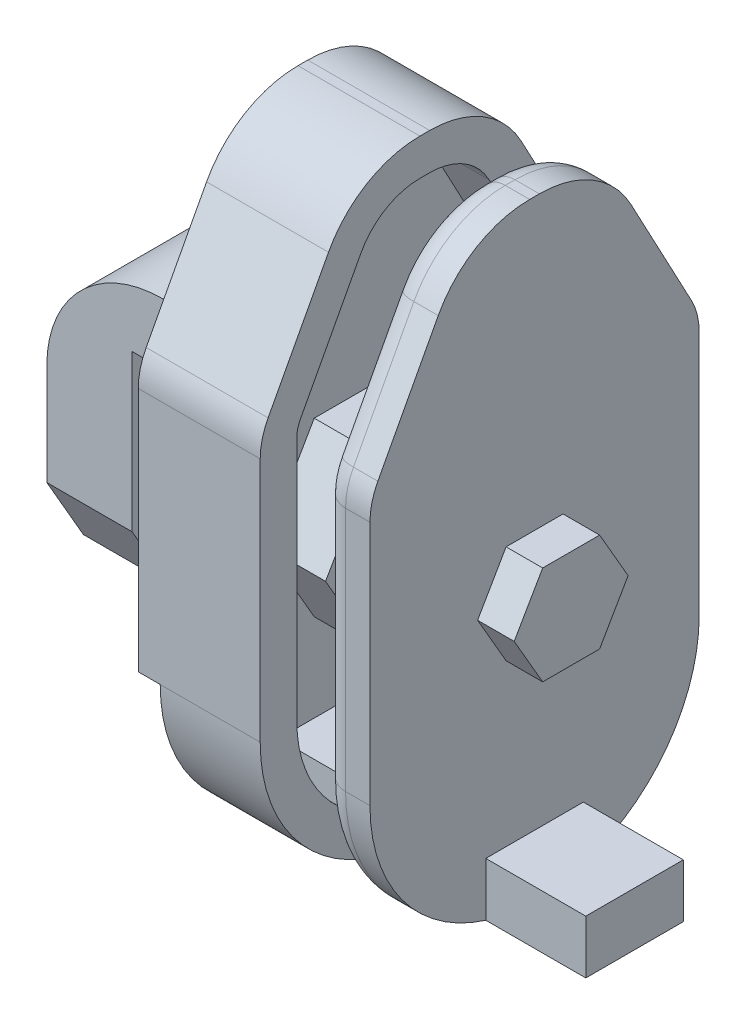
from build123d import *

# Parameters (mm, degrees)
BOSS_EXTRUDE1_DEPTH = 7
FILLET1_R           = 8.5
FILLET2_R           = 5.5
FILLET3_R           = 13.5
SKETCH3_W           = 27
SKETCH3_H           = 13.5
CUT_EXTRUDE1_DEPTH  = 1.8
BOSS_EXTRUDE2_DEPTH = 5
BOSS_EXTRUDE3_DEPTH = 7
SKETCH10_R          = 2.5
CUT_EXTRUDE3_DEPTH  = 21
CUT_EXTRUDE16_REACH = 42.725
SKETCH19_W          = 12
SKETCH19_H          = 4.5
CHAMFER5_SIZE       = 3
CHAMFER5_SIZE2      = 5.196152423
CUT_EXTRUDE17_DEPTH = 4
SHELL1_START        = -9
SHELL1_OUTLINE_R    = 5.5
SHELL1_DEPTH        = 1
SKETCH21_R          = 4.3
CUT_EXTRUDE18_DEPTH = 5
FILLET5_R           = 9.5
FILLET6_R           = 2.5
BOSS_EXTRUDE5_START = 3
BOSS_EXTRUDE5_DEPTH = 3
SKETCH24_W          = 8
SKETCH24_H          = 10
CUT_EXTRUDE19_DEPTH = 8.2
CUT_EXTRUDE20_DEPTH = 5
BOSS_EXTRUDE6_DEPTH = 4
SKETCH27_W          = 8
SKETCH27_H          = 4.393796958
BOSS_EXTRUDE8_DEPTH = 12.2
BOSS_EXTRUDE9_DEPTH = 3
FILLET8_R           = 2


# Read off the part's stored shape, not the designer's step: Shell1
# Some blends are built 0.0001 mm under size
with BuildPart() as part:
    # Sketch2 → Boss-Extrude1 (new body)
    with BuildSketch(Plane(origin=(0, 0, 0), x_dir=(0, 0, -1), z_dir=(1, 0, 0))):
        Polygon((-13.5, -17.5), (13.5, -17.5), (13.5, 17.5), (5.5, 32.5), (-5.5, 32.5), (-13.5, 17.5), align=None)
    extrude(amount=BOSS_EXTRUDE1_DEPTH)

    # Fillet1
    fillet1_edges = [part.edges().sort_by_distance(p)[0] for p in [
        (3.5, 32.5, 5.5),
        (3.5, 32.5, -5.5),
    ]]
    fillet(fillet1_edges, radius=FILLET1_R)

    # Fillet2
    fillet2_edges = [part.edges().sort_by_distance(p)[0] for p in [
        (3.5, 17.5, -13.5),
        (3.5, 17.5, 13.5),
    ]]
    fillet(fillet2_edges, radius=FILLET2_R)

    # Fillet3
    fillet3_edges = [part.edges().sort_by_distance(p)[0] for p in [
        (3.5, -17.5, 13.5),
        (3.5, -17.5, -13.5),
    ]]
    fillet(fillet3_edges, radius=FILLET3_R - 0.0001)  # a hair under: the kernel refuses the full size

    # Sketch3 → Cut-Extrude1 (cut)
    with BuildSketch(Plane.ZY):
        with Locations((0, -10.75)):
            Rectangle(SKETCH3_W, SKETCH3_H)
    extrude(amount=-CUT_EXTRUDE1_DEPTH, mode=Mode.SUBTRACT)

    # Sketch6 → Boss-Extrude2 (add)
    with BuildSketch(Plane.ZY):
        with BuildLine():
            Line((-13.5, 14), (13.5, 14))
            Line((13.5, 14), (13.5, 16.125))
            ThreePointArc((13.5, 16.125), (13.293303509, 17.618632471), (12.688749833, 19))
            Line((12.688749833, 19), (-12.688749833, 19))
            ThreePointArc((-12.688749833, 19), (-13.293303509, 17.618632471), (-13.5, 16.125))
            Line((-13.5, 16.125), (-13.5, 14))
        make_face()
    extrude(amount=BOSS_EXTRUDE2_DEPTH)

    # Sketch9 → Boss-Extrude3 (add)
    with BuildSketch(Plane.ZY.offset(5)):
        with BuildLine():
            Line((-13.5, 14), (-13.5, -4))
            Line((-13.5, -4), (13.5, -4))
            Line((13.5, -4), (13.5, 14))
            Line((13.5, 14), (13.5, 16.125))
            ThreePointArc((13.5, 16.125), (13.293303509, 17.618632471), (12.688749833, 19))
            Line((12.688749833, 19), (-12.688749833, 19))
            ThreePointArc((-12.688749833, 19), (-13.293303509, 17.618632471), (-13.5, 16.125))
            Line((-13.5, 16.125), (-13.5, 14))
        make_face()
    extrude(amount=BOSS_EXTRUDE3_DEPTH)

    # Sketch10 → Cut-Extrude3 (cut)
    with BuildSketch(Plane(origin=(7, 0, 0), x_dir=(0, 0, -1), z_dir=(1, 0, 0))):
        with Locations((0, 4.75)):
            Circle(SKETCH10_R)
    extrude(amount=-CUT_EXTRUDE3_DEPTH, mode=Mode.SUBTRACT)

    # Sketch19 → Cut-Extrude16 (cut, up to next)
    with BuildSketch(Plane.XZ.offset(4), mode=Mode.PRIVATE) as cut_extrude16_sk1:
        with Locations((-6, -11.25)):
            Rectangle(SKETCH19_W, SKETCH19_H)
    cut_extrude16_tool1 = extrude(cut_extrude16_sk1.sketch, amount=-CUT_EXTRUDE16_REACH, mode=Mode.PRIVATE) & part.part
    # Sketch19 → Cut-Extrude16 (cut, up to next)
    with BuildSketch(Plane.XZ.offset(4), mode=Mode.PRIVATE) as cut_extrude16_sk2:
        with Locations((-6, 11.25)):
            Rectangle(SKETCH19_W, SKETCH19_H)
    cut_extrude16_tool2 = extrude(cut_extrude16_sk2.sketch, amount=-CUT_EXTRUDE16_REACH, mode=Mode.PRIVATE) & part.part
    add(cut_extrude16_tool1.solids().sort_by_distance((-6, -4, -11.25))[0], mode=Mode.SUBTRACT)
    add(cut_extrude16_tool2.solids().sort_by_distance((-6, -4, 11.25))[0], mode=Mode.SUBTRACT)

    # Chamfer5
    chamfer5_edges = [part.edges().sort_by_distance(p)[0] for p in [
        (-8.5, -4, -9),
        (-8.5, -4, 9),
    ]]
    chamfer5_side = [part.faces().sort_by_distance(p)[0] for p in [
        (-8.5, -4, 0),
    ]]
    chamfer(chamfer5_edges, length=CHAMFER5_SIZE, length2=CHAMFER5_SIZE2, reference=chamfer5_side[0])

    # Sketch20 → Cut-Extrude17 (cut)
    with BuildSketch(Plane(origin=(7, 0, 0), x_dir=(0, 0, -1), z_dir=(1, 0, 0))):
        Polygon((2.33826859, 8.8), (-2.33826859, 8.8), (-4.67653718, 4.75), (-2.33826859, 0.7), (2.33826859, 0.7), (4.67653718, 4.75), align=None)
    extrude(amount=-CUT_EXTRUDE17_DEPTH, mode=Mode.SUBTRACT)

    # Shell1 outline → Shell1 (cut)
    with BuildSketch(Plane.YZ.offset(SHELL1_START)):
        Polygon((16, -6), (16, 6), (2, 6), (-1, 4.267949192), (-1, -4.267949192), (2, -6), align=None)
        with Locations((4.75, 0)):
            Circle(SHELL1_OUTLINE_R, mode=Mode.SUBTRACT)
    extrude(amount=SHELL1_DEPTH, mode=Mode.SUBTRACT)

    # Sketch21 → Cut-Extrude18 (cut)
    with BuildSketch(Plane.ZY.offset(12)):
        with Locations((0, 4.75)):
            Circle(SKETCH21_R)
    extrude(amount=-CUT_EXTRUDE18_DEPTH, mode=Mode.SUBTRACT)

    # Fillet5
    fillet5_edges = [part.edges().sort_by_distance(p)[0] for p in [
        (-12, 19, 0),
    ]]
    fillet(fillet5_edges, radius=FILLET5_R)

    # Fillet6
    fillet6_edges = [part.edges().sort_by_distance(p)[0] for p in [
        (0, 19, 0),
    ]]
    fillet(fillet6_edges, radius=FILLET6_R - 0.0001)  # a hair under: the kernel refuses the full size

    # Sketch23 → Boss-Extrude5 (add)
    with BuildSketch(Plane(origin=(7, 0, 0), x_dir=(0, 0, -1), z_dir=(1, 0, 0)).offset(BOSS_EXTRUDE5_START)):
        with BuildLine():
            Line((-13.5, 16.125), (-13.5, -4))
            ThreePointArc((-13.5, -4), (-9.545941546, -13.545941546), (0, -17.5))
            ThreePointArc((0, -17.5), (9.545941546, -13.545941546), (13.5, -4))
            Line((13.5, -4), (13.5, 16.125))
            ThreePointArc((13.5, 16.125), (13.335783751, 17.458945938), (12.852941176, 18.713235294))
            Line((12.852941176, 18.713235294), (7.9, 28))
            ThreePointArc((7.9, 28), (4.773213921, 31.288689869), (0.4, 32.5))
            Line((0.4, 32.5), (-0.4, 32.5))
            ThreePointArc((-0.4, 32.5), (-4.773213921, 31.288689869), (-7.9, 28))
            Line((-7.9, 28), (-12.852941176, 18.713235294))
            ThreePointArc((-12.852941176, 18.713235294), (-13.335783751, 17.458945938), (-13.5, 16.125))
        make_face()
        Polygon((-4.67653718, 4.75), (-2.33826859, 0.7), (2.33826859, 0.7), (4.67653718, 4.75), (2.33826859, 8.8), (-2.33826859, 8.8), align=None, mode=Mode.SUBTRACT)
    extrude(amount=-BOSS_EXTRUDE5_DEPTH)

    # Sketch24 → Cut-Extrude19 (cut)
    with BuildSketch(Plane(origin=(10, 0, 0), x_dir=(0, 0, -1), z_dir=(1, 0, 0))):
        with Locations((0, -17.5)):
            Rectangle(SKETCH24_W, SKETCH24_H)
    extrude(amount=-CUT_EXTRUDE19_DEPTH, mode=Mode.SUBTRACT)

    # Sketch25 → Cut-Extrude20 (cut)
    with BuildSketch(Plane(origin=(10, 0, 0), x_dir=(0, 0, -1), z_dir=(1, 0, 0))):
        with BuildLine():
            Line((7, -9.5), (7, -11.826237921))
            ThreePointArc((7, -11.826237921), (9.585144756, -8.28660705), (10.5, -4))
            Line((10.5, -4), (10.5, 16.125))
            ThreePointArc((10.5, 16.125), (10.42535625, 16.731339063), (10.205882353, 17.301470588))
            Line((10.205882353, 17.301470588), (5.252941176, 26.588235294))
            ThreePointArc((5.252941176, 26.588235294), (3.229726655, 28.716211091), (0.4, 29.5))
            Line((0.4, 29.5), (-0.4, 29.5))
            ThreePointArc((-0.4, 29.5), (-3.229726655, 28.716211091), (-5.252941176, 26.588235294))
            Line((-5.252941176, 26.588235294), (-10.205882353, 17.301470588))
            ThreePointArc((-10.205882353, 17.301470588), (-10.42535625, 16.731339063), (-10.5, 16.125))
            Line((-10.5, 16.125), (-10.5, -4))
            ThreePointArc((-10.5, -4), (-9.585144756, -8.28660705), (-7, -11.826237921))
            Line((-7, -11.826237921), (-7, -9.5))
            Line((-7, -9.5), (7, -9.5))
        make_face()
        Polygon((4.070319398, 11.8), (-4.070319398, 11.8), (-8.140638796, 4.75), (-4.070319398, -2.3), (4.070319398, -2.3), (8.140638796, 4.75), align=None, mode=Mode.SUBTRACT)
    extrude(amount=-CUT_EXTRUDE20_DEPTH, mode=Mode.SUBTRACT)


with BuildPart() as body_2:
    # Sketch26 → Boss-Extrude6 (new body)
    with BuildSketch(Plane(origin=(15, 0, 0), x_dir=(0, 0, -1), z_dir=(1, 0, 0))):
        with BuildLine():
            Line((4, -12.5), (4, -16.893796958))
            ThreePointArc((4, -16.893796958), (10.86853256, -12.007808689), (13.5, -4))
            Line((13.5, -4), (13.5, 16.125))
            ThreePointArc((13.5, 16.125), (13.335783751, 17.458945938), (12.852941176, 18.713235294))
            Line((12.852941176, 18.713235294), (7.9, 28))
            ThreePointArc((7.9, 28), (4.773213921, 31.288689869), (0.4, 32.5))
            Line((0.4, 32.5), (-0.4, 32.5))
            ThreePointArc((-0.4, 32.5), (-4.773213921, 31.288689869), (-7.9, 28))
            Line((-7.9, 28), (-12.852941176, 18.713235294))
            ThreePointArc((-12.852941176, 18.713235294), (-13.335783751, 17.458945938), (-13.5, 16.125))
            Line((-13.5, 16.125), (-13.5, -4))
            ThreePointArc((-13.5, -4), (-10.86853256, -12.007808689), (-4, -16.893796958))
            Line((-4, -16.893796958), (-4, -12.5))
            Line((-4, -12.5), (4, -12.5))
        make_face()
    extrude(amount=BOSS_EXTRUDE6_DEPTH)

    # Sketch27 → Boss-Extrude8 (add)
    with BuildSketch(Plane.ZY.offset(-15)):
        with Locations((0, -14.696898479)):
            Rectangle(SKETCH27_W, SKETCH27_H)
    extrude(amount=-BOSS_EXTRUDE8_DEPTH)

    # Sketch28 → Boss-Extrude9 (add)
    with BuildSketch(Plane(origin=(19, 0, 0), x_dir=(0, 0, -1), z_dir=(1, 0, 0))):
        Polygon((2.335381839, 8.795), (-2.335381839, 8.795), (-4.670763678, 4.75), (-2.335381839, 0.705), (2.335381839, 0.705), (4.670763678, 4.75), align=None)
    extrude(amount=BOSS_EXTRUDE9_DEPTH)

    # Fillet8
    # the kernel refuses this fillet: 2 mm, written as the material it takes off along each edge
    with BuildSketch(Plane(origin=(15, -4, 0), x_dir=(0, 0, 1), z_dir=(0, 1, 0))) as fillet8_piece_1:
        with BuildLine():
            CenterArc((13.5 - FILLET8_R, FILLET8_R), FILLET8_R, 270, 90)
            Line((13.5 - FILLET8_R, 0), (13.5, 0))
            Line((13.5, 0), (13.5, FILLET8_R))
        make_face()
    revolve(axis=Axis((15, -4, 0), (1, 0, 0)), revolution_arc=93.990945472, mode=Mode.SUBTRACT)
    with BuildSketch(Plane(origin=(15, 16.125, 13.5), x_dir=(1, 0, 0), z_dir=(0, -1, 0))) as fillet8_piece_2:
        with BuildLine():
            CenterArc((FILLET8_R, -FILLET8_R), FILLET8_R, 90, 90)
            Line((0, -FILLET8_R), (0, 0))
            Line((0, 0), (FILLET8_R, 0))
        make_face()
    extrude(amount=20.125, mode=Mode.SUBTRACT)
    with BuildSketch(Plane(origin=(15, 16.125, 8), x_dir=(0, 0.47058823529411903, 0.8823529411764699), z_dir=(0, 0.8823529411764699, -0.47058823529411903))) as fillet8_piece_3:
        with BuildLine():
            CenterArc((5.5 - FILLET8_R, FILLET8_R), FILLET8_R, 270, 90)
            Line((5.5 - FILLET8_R, 0), (5.5, 0))
            Line((5.5, 0), (5.5, FILLET8_R))
        make_face()
    revolve(axis=Axis((15, 16.125, 8), (1, 0, 0)), revolution_arc=28.072486936, mode=Mode.SUBTRACT)
    with BuildSketch(Plane(origin=(15, 28, 7.9), x_dir=(0, -0.47058823529411736, -0.8823529411764708), z_dir=(0, -0.8823529411764708, 0.4705882352941174)), Plane(origin=(15, 18.713235294, -12.852941176), x_dir=(0, -0.4705882352941178, 0.8823529411764706), z_dir=(0, 0.8823529411764706, 0.47058823529411786))) as fillet8_piece_4:
        with BuildLine():
            CenterArc((FILLET8_R, FILLET8_R), FILLET8_R, 180, 90)
            Line((0, FILLET8_R), (0, 0))
            Line((0, 0), (FILLET8_R, 0))
        make_face()
    extrude(amount=10.525, mode=Mode.SUBTRACT)
    with BuildSketch(Plane(origin=(15, 24, 0.4), x_dir=(0, 1, 0), z_dir=(0, 0, -1))) as fillet8_piece_5:
        with BuildLine():
            CenterArc((8.5 - FILLET8_R, FILLET8_R), FILLET8_R, 270, 90)
            Line((8.5, FILLET8_R), (8.5, 0))
            Line((8.5, 0), (8.5 - FILLET8_R, 0))
        make_face()
    revolve(axis=Axis((15, 24, 0.4), (1, 0, 0)), revolution_arc=61.927513064, mode=Mode.SUBTRACT)
    with BuildSketch(Plane(origin=(15, 32.5, -0.4), x_dir=(0, -1, 0), z_dir=(0, 0, 1))) as fillet8_piece_6:
        with BuildLine():
            CenterArc((FILLET8_R, FILLET8_R), FILLET8_R, 180, 90)
            Line((0, FILLET8_R), (0, 0))
            Line((0, 0), (FILLET8_R, 0))
        make_face()
    extrude(amount=0.8, mode=Mode.SUBTRACT)
    with BuildSketch(Plane(origin=(15, 24, -0.4), x_dir=(0, 0.4705882352941177, -0.8823529411764706), z_dir=(0, -0.8823529411764706, -0.4705882352941177))) as fillet8_piece_7:
        with BuildLine():
            CenterArc((8.5 - FILLET8_R, FILLET8_R), FILLET8_R, 270, 90)
            Line((8.5, FILLET8_R), (8.5, 0))
            Line((8.5, 0), (8.5 - FILLET8_R, 0))
        make_face()
    revolve(axis=Axis((15, 24, -0.4), (1, 0, 0)), revolution_arc=61.927513064, mode=Mode.SUBTRACT)
    with BuildSketch(Plane(origin=(15, 16.125, -8), x_dir=(0, 0, -1), z_dir=(0, -1, 0))) as fillet8_piece_8:
        with BuildLine():
            CenterArc((5.5 - FILLET8_R, FILLET8_R), FILLET8_R, 270, 90)
            Line((5.5, FILLET8_R), (5.5, 0))
            Line((5.5, 0), (5.5 - FILLET8_R, 0))
        make_face()
    revolve(axis=Axis((15, 16.125, -8), (1, 0, 0)), revolution_arc=28.072486936, mode=Mode.SUBTRACT)
    with BuildSketch(Plane(origin=(15, -4, -13.5), x_dir=(0, 0, 1), z_dir=(0, 1, 0))) as fillet8_piece_9:
        with BuildLine():
            CenterArc((FILLET8_R, FILLET8_R), FILLET8_R, 180, 90)
            Line((0, FILLET8_R), (0, 0))
            Line((0, 0), (FILLET8_R, 0))
        make_face()
    extrude(amount=20.125, mode=Mode.SUBTRACT)
    with BuildSketch(Plane(origin=(15, -4, 0), x_dir=(0, -0.9975750615108255, 0.06959882651074423), z_dir=(0, 0.06959882651074423, 0.9975750615108255))) as fillet8_piece_10:
        with BuildLine():
            CenterArc((13.5 - FILLET8_R, FILLET8_R), FILLET8_R, 270, 90)
            Line((13.5, FILLET8_R), (13.5, 0))
            Line((13.5, 0), (13.5 - FILLET8_R, 0))
        make_face()
    revolve(axis=Axis((15, -4, 0), (1, 0, 0)), revolution_arc=93.990945472, mode=Mode.SUBTRACT)
    with BuildSketch(Plane(origin=(15, -16.893796958, 9), x_dir=(0, 1, 0), z_dir=(0, 0, -1))) as fillet8_piece_11:
        with BuildLine():
            CenterArc((FILLET8_R, FILLET8_R), FILLET8_R, 180, 90)
            Line((0, FILLET8_R), (0, 0))
            Line((0, 0), (FILLET8_R, 0))
        make_face()
    extrude(amount=18, mode=Mode.SUBTRACT)


solid = Compound([part.part, body_2.part])
